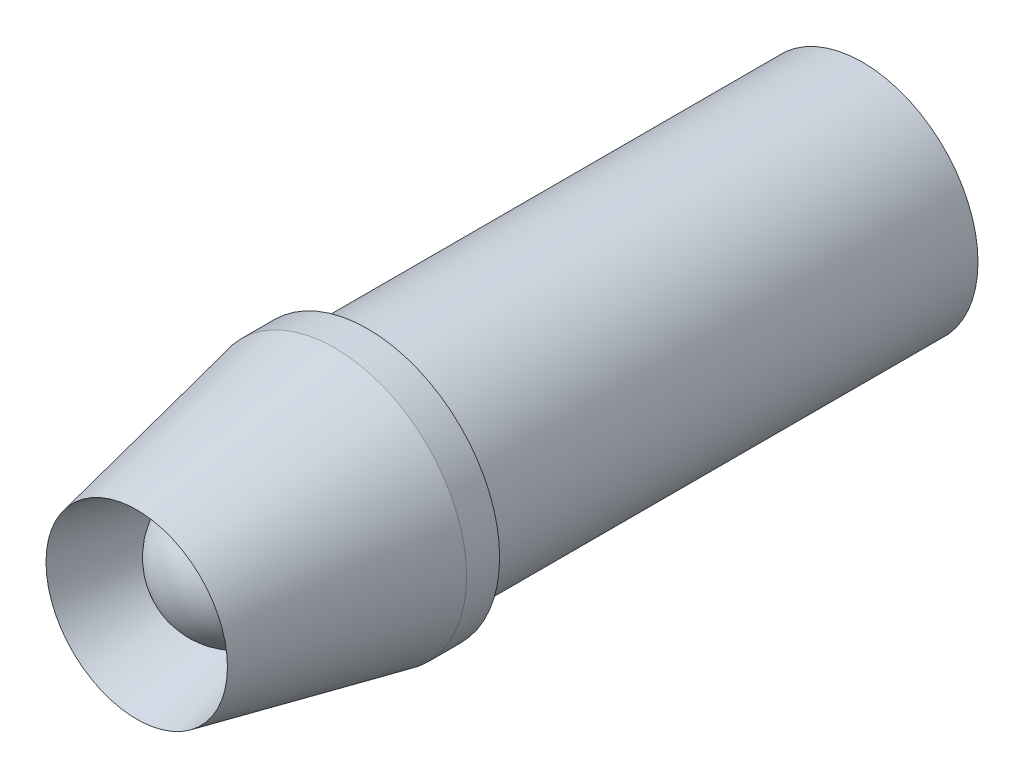
from build123d import *

# Parameters (mm, degrees)
ESQUISSE1_R        = 4
ESQUISSE1_R_2      = 2
BOSS_EXTRU_1_DEPTH = 7
CHANFREIN1_SIZE    = 6
CHANFREIN1_SIZE2   = 1.25
CHANFREIN2_SIZE    = 0.75
CHANFREIN2_SIZE_2  = 3
ESQUISSE4_R        = 2
BOSS_EXTRU_2_DEPTH = 2
CONG_1_R           = 2
ESQUISSE5_R        = 3.5
BOSS_EXTRU_3_DEPTH = 15


# Some blends are built 0.0001 mm under size
with BuildPart() as part:
    # Esquisse1 → Boss.-Extru.1 (new body)
    with BuildSketch(Plane.XY):
        Circle(ESQUISSE1_R)
        Circle(ESQUISSE1_R_2, mode=Mode.SUBTRACT)
    extrude(amount=BOSS_EXTRU_1_DEPTH)

    # Chanfrein1
    chanfrein1_edges = [part.edges().sort_by_distance(p)[0] for p in [
        (-4, 0, 7),
    ]]
    chanfrein1_side = [part.faces().sort_by_distance(p)[0] for p in [
        (-4, 0, 3.5),
    ]]
    chamfer(chanfrein1_edges, length=CHANFREIN1_SIZE, length2=CHANFREIN1_SIZE2, reference=chanfrein1_side[0])

    # Chanfrein2
    # the kernel refuses this chamfer: 3, 0.75 mm, written as the material it takes off along each edge
    with BuildSketch(Plane(origin=(0, 0, 7), x_dir=(1, 0, 0), z_dir=(0, -1, 0))) as chanfrein2_piece_1:
        Polygon((2 + CHANFREIN2_SIZE, 0), (2, -CHANFREIN2_SIZE_2), (2, 0), align=None)
    revolve(axis=Axis((0, 0, 7), (0, 0, 1)), mode=Mode.SUBTRACT)

    # Esquisse5 → Boss.-Extru.3 (add)
    with BuildSketch(Plane(origin=(0, 0, 0), x_dir=(-1, 0, 0), z_dir=(0, 0, -1))):
        with Locations(Location((0, 0, 0), (0, 0, 180))):
            Circle(ESQUISSE5_R)
    extrude(amount=BOSS_EXTRU_3_DEPTH)


with BuildPart() as body_2:
    # Esquisse4 → Boss.-Extru.2 (new body)
    with BuildSketch(Plane.XY.offset(4)):
        Circle(ESQUISSE4_R)
    extrude(amount=BOSS_EXTRU_2_DEPTH)

    # Congé1
    cong_1_edges = [body_2.edges().sort_by_distance(p)[0] for p in [
        (-2, 0, 6),
    ]]
    fillet(cong_1_edges, radius=CONG_1_R - 0.0001)  # a hair under: the kernel refuses the full size


solid = Compound([part.part, body_2.part])
